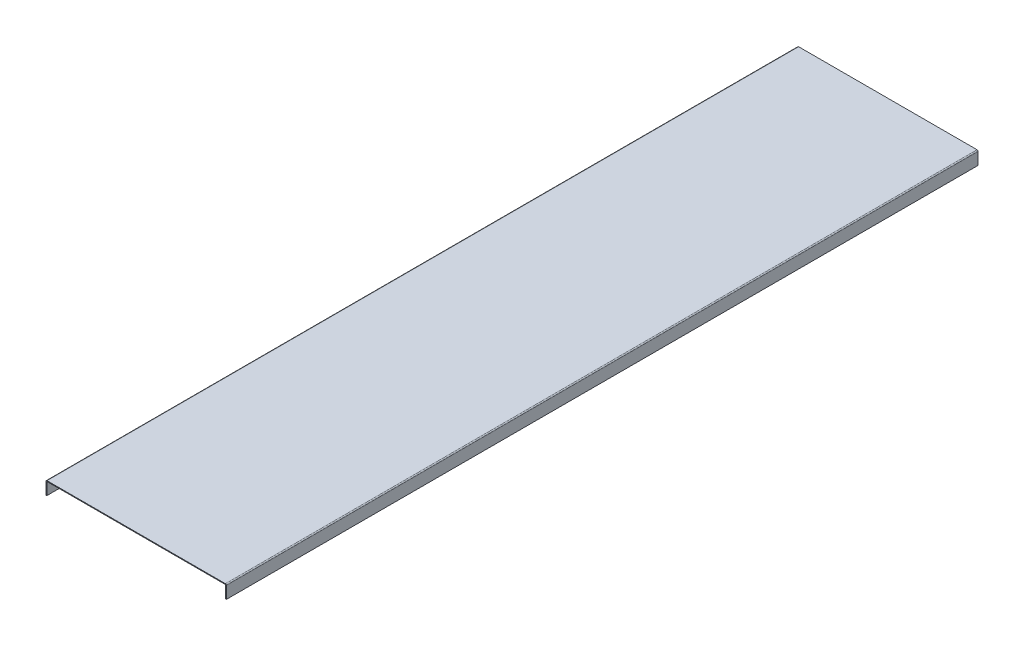
from build123d import *

# Parameters (mm, degrees)
SKETCH1_W                      = 480
SKETCH1_H                      = 2
BASE_FLANGE1_DEPTH             = 2000
EDGE_FLANGE1_STRIP_W           = 9.4732
EDGE_FLANGE1_STRIP_H           = 2
EDGE_FLANGE1_STRIP_CUT_DEPTH   = 2000
EDGE_FLANGE1_STRIP_2_W         = 9.4732
EDGE_FLANGE1_STRIP_2_H         = 2
EDGE_FLANGE1_STRIP_CUT_2_DEPTH = 2000
EDGE_FLANGE1_DEPTH             = 2000
EDGE_FLANGE1_BEND_DEPTH        = 2000


# Sheet-metal steps are written as plain solids
with BuildPart() as part:
    # Sketch1 → Base-Flange1 (new body)
    with BuildSketch(Plane.XY):
        with Locations((0, -1)):
            Rectangle(SKETCH1_W, SKETCH1_H)
    extrude(amount=BASE_FLANGE1_DEPTH)

    # Edge-Flange1 strip (across the edge) → Edge-Flange1 strip cut (cut)
    with BuildSketch(Plane(origin=(240, -2, 0), x_dir=(-1, 0, 0), z_dir=(0, 0, 1))):
        with Locations((-2, -1)):
            Rectangle(EDGE_FLANGE1_STRIP_W, EDGE_FLANGE1_STRIP_H)
    extrude(amount=EDGE_FLANGE1_STRIP_CUT_DEPTH, mode=Mode.SUBTRACT)

    # Edge-Flange1 strip 2 (across the edge) → Edge-Flange1 strip cut 2 (cut)
    with BuildSketch(Plane(origin=(-240, -2, 2000), x_dir=(1, 0, 0), z_dir=(0, 0, -1))):
        with Locations((-2, -1)):
            Rectangle(EDGE_FLANGE1_STRIP_2_W, EDGE_FLANGE1_STRIP_2_H)
    extrude(amount=EDGE_FLANGE1_STRIP_CUT_2_DEPTH, mode=Mode.SUBTRACT)

    # Edge-Flange1 section (across the edge) → Edge-Flange1 (add)
    with BuildSketch(Plane(origin=(240, -2, 0), x_dir=(-1, 0, 0), z_dir=(0, 0, 1))):
        with BuildLine():
            Line((0, 0.7366), (0, 33))
            Line((0, 33), (2, 33))
            Line((2, 33), (2, 0.7366))
            ThreePointArc((2, 0.7366), (2.215745145, 0.215745145), (2.7366, 0))
            Line((2.7366, 0), (2.7366, -2))
            ThreePointArc((2.7366, -2), (0.801531583, -1.198468417), (0, 0.7366))
        make_face()
    extrude(amount=EDGE_FLANGE1_DEPTH)

    # Edge-Flange1 section 2 (across the edge) → Edge-Flange1 bend (add)
    with BuildSketch(Plane(origin=(-240, -2, 2000), x_dir=(1, 0, 0), z_dir=(0, 0, -1))):
        with BuildLine():
            Line((0, 0.7366), (0, 33))
            Line((0, 33), (2, 33))
            Line((2, 33), (2, 0.7366))
            ThreePointArc((2, 0.7366), (2.215745145, 0.215745145), (2.7366, 0))
            Line((2.7366, 0), (2.7366, -2))
            ThreePointArc((2.7366, -2), (0.801531583, -1.198468417), (0, 0.7366))
        make_face()
    extrude(amount=EDGE_FLANGE1_BEND_DEPTH)


solid = part.part
